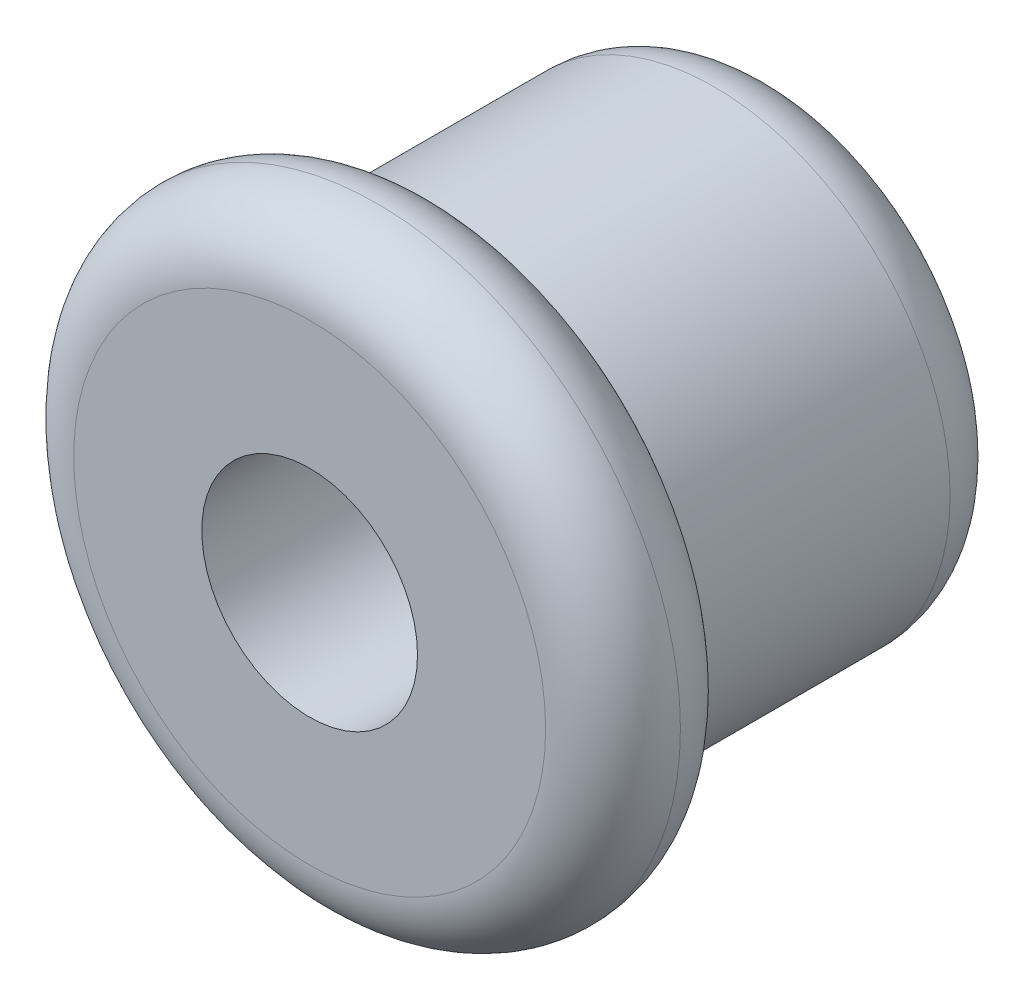
from build123d import *

# Parameters (mm, degrees)
SKETCH_1_R               = 1.75
EXTRUDE_1_DEPTH          = 2.5
SKETCH_2_R               = 2.25
EXTRUDE_2_DEPTH          = 1
CUT_EXTRUDE_1_DEPTH      = 5.730221982
CUT_EXTRUDE_1_DEPTH_BACK = 5.730221982
SKETCH_3_R               = 0.8
FILLET_2_R               = 0.5


with BuildPart() as part:
    # 草图1 → 凸台-拉伸1 (new body)
    with BuildSketch(Plane.XY):
        Circle(SKETCH_1_R)
    extrude(amount=EXTRUDE_1_DEPTH)

    # 草图2 → 凸台-拉伸2 (add)
    with BuildSketch(Plane.XY.offset(2.5)):
        Circle(SKETCH_2_R)
    extrude(amount=EXTRUDE_2_DEPTH)

    # 草图3 → 切除-拉伸1 (cut, two sides: drawn at the far end of the back side and taken through both)
    with BuildSketch(Plane.XY.offset(3.5).offset(-CUT_EXTRUDE_1_DEPTH_BACK)):
        Circle(SKETCH_3_R)
    extrude(amount=CUT_EXTRUDE_1_DEPTH + CUT_EXTRUDE_1_DEPTH_BACK, mode=Mode.SUBTRACT)

    # 圆角2
    fillet_2_edges = [part.edges().sort_by_distance(p)[0] for p in [
        (-1.75, 0, 0),
        (-2.25, 0, 2.5),
        (-2.25, 0, 3.5),
    ]]
    fillet(fillet_2_edges, radius=FILLET_2_R - 0.0001)  # a hair under: the kernel refuses the full size


solid = part.part
